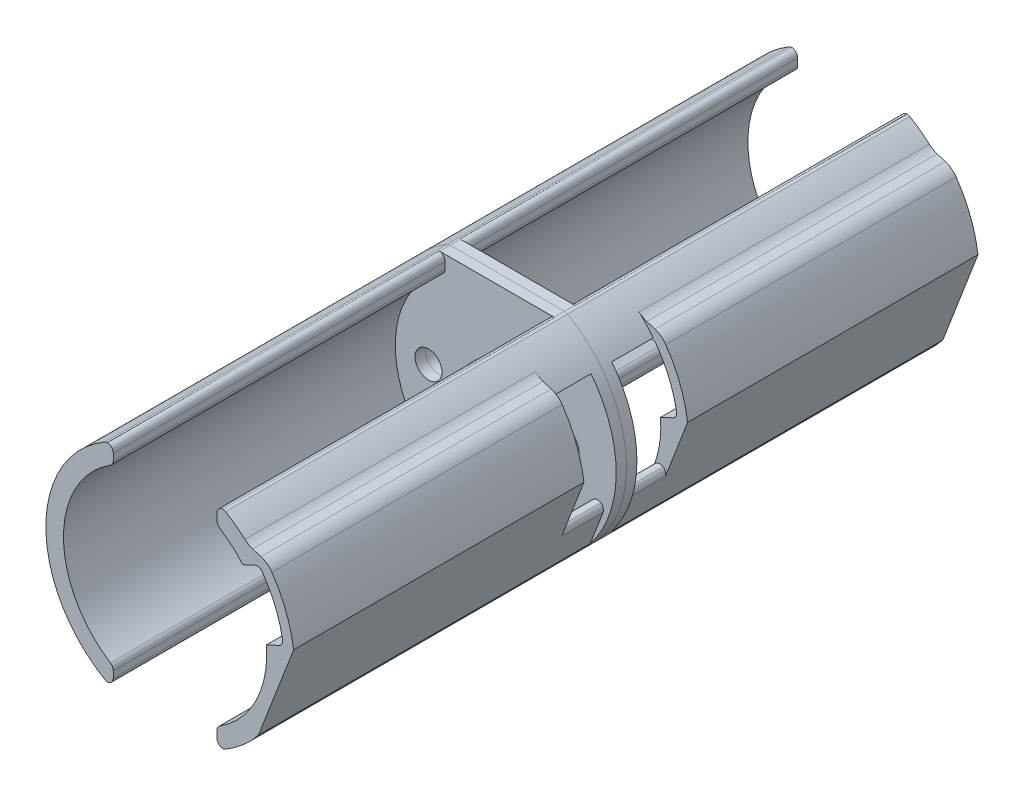
from build123d import *

# Parameters (mm, degrees)
SKETCH1_R           = 14.605
SKETCH1_R_2         = 12.446
BOSS_EXTRUDE1_DEPTH = 40.64
BOSS_EXTRUDE2_START = 1.27
SKETCH2_R           = 14.605
SKETCH2_R_2         = 3.556
SKETCH2_R_3         = 1.651
BOSS_EXTRUDE2_DEPTH = 1.27
SKETCH3_W           = 34.056453184
SKETCH3_H           = 6.418177278
SKETCH3_W_2         = 34.979066167
SKETCH3_H_2         = 5.575791511
CUT_EXTRUDE1_DEPTH  = 47.723229233
SKETCH4_W           = 12.7
SKETCH4_H           = 40.64
CUT_EXTRUDE2_DEPTH  = 51.100654936
CUT_EXTRUDE3_DEPTH  = 40.64
BOSS_EXTRUDE3_DEPTH = 41.91
SKETCH7_R           = 15.875
SKETCH7_R_2         = 14.605
CUT_EXTRUDE4_DEPTH  = 6.35
CUT_EXTRUDE5_DEPTH  = 5.08
CUT_EXTRUDE6_REACH  = 48.533
BOSS_EXTRUDE5_DEPTH = 35.56
FILLET1_R           = 0.762
FILLET2_R           = 2.54


with BuildPart() as part:
    # Sketch1 → Boss-Extrude1 (new body)
    with BuildSketch(Plane.XY):
        Circle(SKETCH1_R)
        Circle(SKETCH1_R_2, mode=Mode.SUBTRACT)
    extrude(amount=BOSS_EXTRUDE1_DEPTH)

    # Sketch2 → Boss-Extrude2 (add)
    with BuildSketch(Plane(origin=(0, 0, 0), x_dir=(-1, 0, 0), z_dir=(0, 0, -1)).offset(BOSS_EXTRUDE2_START)):
        Circle(SKETCH2_R)
        Circle(SKETCH2_R_2, mode=Mode.SUBTRACT)
        with Locations((-8.382, 0)):
            Circle(SKETCH2_R_3, mode=Mode.SUBTRACT)
        with Locations((8.382, 0)):
            Circle(SKETCH2_R_3, mode=Mode.SUBTRACT)
    extrude(amount=-BOSS_EXTRUDE2_DEPTH)

    # Sketch3 → Cut-Extrude1 (cut, through all)
    with BuildSketch(Plane(origin=(0, 0, -1.27), x_dir=(-1, 0, 0), z_dir=(0, 0, -1))):
        with Locations((0.581647316, 15.909088639)):
            Rectangle(SKETCH3_W, SKETCH3_H)
        with Locations((1.042953807, -15.487895756)):
            Rectangle(SKETCH3_W_2, SKETCH3_H_2)
    extrude(amount=-CUT_EXTRUDE1_DEPTH, mode=Mode.SUBTRACT)

    # Sketch4 → Cut-Extrude2 (cut, through all)
    with BuildSketch(Plane(origin=(0, 12.7, 0), x_dir=(1, 0, 0), z_dir=(0, 1, 0))):
        with Locations((0, -20.32)):
            Rectangle(SKETCH4_W, SKETCH4_H)
    extrude(amount=-CUT_EXTRUDE2_DEPTH, mode=Mode.SUBTRACT)

    # Sketch5 → Cut-Extrude3 (cut)
    with BuildSketch(Plane.XY.offset(40.64)):
        Polygon((8.706975565, 7.656948551), (15.156085268, 10.664217794), (18.376436422, 3.758152456), (11.927326719, 0.750883214), align=None)
    extrude(amount=-CUT_EXTRUDE3_DEPTH, mode=Mode.SUBTRACT)

    # Sketch6 → Boss-Extrude3 (add)
    with BuildSketch(Plane(origin=(0, 0, -1.27), x_dir=(-1, 0, 0), z_dir=(0, 0, -1))):
        with BuildLine():
            Line((-12.527218586, 9.751124012), (-10.16966665, 10.48255242))
            ThreePointArc((-10.16966665, 10.48255242), (-10.873649709, 9.75037266), (-11.525041099, 8.971034091))
            ThreePointArc((-11.525041099, 8.971034091), (-13.467409843, 5.651096984), (-14.475687068, 1.93920316))
            ThreePointArc((-14.475687068, 1.93920316), (-14.575462242, 0.928399389), (-14.604741501, -0.086894693))
            Line((-14.604741501, -0.086894693), (-15.734442466, 2.107829522))
            ThreePointArc((-15.734442466, 2.107829522), (-14.638488959, 6.142496722), (-12.527218586, 9.751124012))
        make_face()
    extrude(amount=-BOSS_EXTRUDE3_DEPTH)

    # Sketch7 → Cut-Extrude4 (cut)
    with BuildSketch(Plane(origin=(0, 0, -1.27), x_dir=(-1, 0, 0), z_dir=(0, 0, -1))):
        Circle(SKETCH7_R)
        Circle(SKETCH7_R_2, mode=Mode.SUBTRACT)
    extrude(amount=-CUT_EXTRUDE4_DEPTH, mode=Mode.SUBTRACT)

    # Sketch8 → Cut-Extrude5 (cut)
    with BuildSketch(Plane.XY):
        with BuildLine():
            Line((14.475687068, 1.93920316), (12.407758156, 0.974912072))
            ThreePointArc((12.407758156, 0.974912072), (12.445878018, -0.05510311), (12.398639212, -1.084740374))
            Line((12.398639212, -1.084740374), (14.549423566, -1.272909623))
            ThreePointArc((14.549423566, -1.272909623), (14.601153344, 0.335180604), (14.475687068, 1.93920316))
        make_face()
        with BuildLine():
            Line((14.549423566, -1.272909623), (12.398639212, -1.084740374))
            ThreePointArc((12.398639212, -1.084740374), (12.226851946, -2.325297292), (11.931259886, -3.542309069))
            Line((11.931259886, -3.542309069), (13.780666558, -4.837277563))
            ThreePointArc((13.780666558, -4.837277563), (14.276718156, -3.079179062), (14.549423566, -1.272909623))
        make_face()
    extrude(amount=CUT_EXTRUDE5_DEPTH, mode=Mode.SUBTRACT)

    # Cut-Extrude6: up to this face of the body (flat: up to its plane)
    cut_extrude6_end = Plane(part.part.faces().sort_by_distance((9.524357094, -7.422304107, 0))[0])
    # Sketch11 → Cut-Extrude6 (cut, up to the picked face)
    with BuildSketch(Plane.XY.offset(40.64), mode=Mode.PRIVATE) as cut_extrude6_sk1:
        Polygon((15.734442466, 2.107829522), (11.428920073, -9.093173867), (14.392518886, -10.232343334), (18.698041279, 0.968660056), align=None)
    cut_extrude6_tool1 = split(extrude(cut_extrude6_sk1.sketch, amount=-CUT_EXTRUDE6_REACH, mode=Mode.PRIVATE), bisect_by=cut_extrude6_end, keep=Keep.BOTH, mode=Mode.PRIVATE)
    add(cut_extrude6_tool1.solids().sort_by(Axis((15.063481, -4.062257, 40.64), (0, 0, -1)))[0], mode=Mode.SUBTRACT)

    # Sketch12 → Boss-Extrude5 (add)
    with BuildSketch(Plane.XY.offset(40.64)):
        Polygon((14.577046288, -0.903186872), (15.734442466, 2.107829522), (15.155744377, 2.330273663), (13.998348199, -0.680742731), align=None)
    extrude(amount=-BOSS_EXTRUDE5_DEPTH)

    # Fillet1
    # the kernel refuses this fillet: 0.762 mm, written as the material it adds along each edge
    with BuildSketch(Plane(origin=(14.475687068, 1.93920316, 40.64), x_dir=(-0.1526781379658876, 0.9882759666142191, 0), z_dir=(0, 0, -1))) as fillet1_piece_1:
        with BuildLine():
            CenterArc((0.57198511, -0.76184596), FILLET1_R, 88.847914045, 74.934246566)
            Line((-0.159692452, -0.549026914), (0, 0))
            ThreePointArc((0, 0), (0.29365307, 0.002952442), (0.587306139, 0))
        make_face()
    extrude(amount=35.56)
    with BuildSketch(Plane(origin=(11.525041099, 8.971034091, 40.64), x_dir=(0.5968718617370223, -0.8023365756754336, 0), z_dir=(0, 0, -1))) as fillet1_piece_2:
        with BuildLine():
            CenterArc((0.62099819, 0.761818426), FILLET1_R, 191.646188227, 79.60463439)
            Line((-0.12531439, 0.60799537), (0, 0))
            ThreePointArc((0, 0), (0.318816035, -0.00348017), (0.63763207, 0))
        make_face()
    extrude(amount=35.56)
    # the kernel refuses this fillet: 0.762 mm, written as the material it takes off along each edge
    with BuildSketch(Plane(origin=(0, 0, 0), x_dir=(-1, 0, 0), z_dir=(0, -1, 0))) as fillet1_2_piece_1:
        with BuildLine():
            CenterArc((3.556 + FILLET1_R, FILLET1_R), FILLET1_R, 180, 90)
            Line((3.556, FILLET1_R), (3.556, 0))
            Line((3.556, 0), (3.556 + FILLET1_R, 0))
        make_face()
    revolve(axis=Axis((0, 0, 0), (0, 0, -1)), mode=Mode.SUBTRACT)
    with BuildSketch(Plane(origin=(11.931259886, -3.542309069, 0), x_dir=(-0.32230782021248533, -0.9466349185561855, 0), z_dir=(0, 0, 1))) as fillet1_2_piece_2:
        with BuildLine():
            CenterArc((1.014668485, 0.761403744), FILLET1_R, 163.802549626, 103.930693134)
            Line((0.282915237, 0.973962404), (0, 0))
            ThreePointArc((0, 0), (0.492264909, 0.009738855), (0.984529818, 0))
        make_face()
    extrude(amount=5.08, mode=Mode.SUBTRACT)
    with BuildSketch(Plane(origin=(13.216640292, -4.442342119, 0), x_dir=(-0.35879353276176223, -0.9334169490899199, 0), z_dir=(0, 0, 1))) as fillet1_2_piece_3:
        with BuildLine():
            CenterArc((FILLET1_R * 0.781652785228, -FILLET1_R), FILLET1_R, 90, 76.026121217)
            Line((-FILLET1_R * 0.1887531327, -FILLET1_R * 0.758520488551), (0, 0))
            Line((0, 0), (FILLET1_R * 0.781652785228, 0))
        make_face()
    extrude(amount=5.08, mode=Mode.SUBTRACT)
    with BuildSketch(Plane(origin=(-7.212213599, 12.7, -1.794261411), x_dir=(1, 0, 0), z_dir=(0, 0, 1)), Plane(origin=(-7.212213599, -12.7, 41.164261411), x_dir=(1, 0, 0), z_dir=(0, 0, -1))) as fillet1_2_piece_4:
        with BuildLine():
            CenterArc((0.204160731, -0.762), FILLET1_R, 90, 30.414529102)
            ThreePointArc((-0.181603647, -0.104862385), (-0.090990033, -0.052105246), (0, 0))
            Line((0, 0), (0.204160731, 0))
        make_face()
    extrude(amount=42.958522823, mode=Mode.SUBTRACT)
    with BuildSketch(Plane(origin=(7.212213599, 12.7, -1.794261411), x_dir=(0.8659975867148599, -0.500048177482969, -1.8558242316030044e-14), z_dir=(0, 0, 1)), Plane(origin=(7.212213599, -12.7, 41.164261411), x_dir=(0.8659975867148587, 0.5000481774829708, -1.8313973834794986e-14), z_dir=(0, 0, -1))) as fillet1_2_piece_5:
        with BuildLine():
            CenterArc((0.204234011, -0.761980363), FILLET1_R, 89.588658346, 30.414529102)
            Line((-0.176802701, -0.102090202), (0, 0))
            ThreePointArc((0, 0), (0.104852282, 0.000376383), (0.209704565, 0))
        make_face()
    extrude(amount=42.958522823, mode=Mode.SUBTRACT)
    with BuildSketch(Plane(origin=(-6.35, 10.704224213, 41.703745389), x_dir=(0, 1, 0), z_dir=(0, 0, -1))) as fillet1_2_piece_6:
        with BuildLine():
            CenterArc((0.425498156, -0.762), FILLET1_R, 90, 57.421029607)
            ThreePointArc((-0.216601212, -0.351692308), (-0.106841566, -0.176744751), (0, 0))
            Line((0, 0), (0.425498156, 0))
        make_face()
    extrude(amount=41.703745389, mode=Mode.SUBTRACT)
    with BuildSketch(Plane(origin=(-6.35, -10.704224213, 41.703745389), x_dir=(0, -1, 0), z_dir=(0, 0, -1)), Plane(origin=(6.35, 10.704224213, 41.703745389), x_dir=(0, 1, 0), z_dir=(0, 0, -1))) as fillet1_2_piece_7:
        with BuildLine():
            CenterArc((0.425498156, 0.762), FILLET1_R, 212.578970393, 57.421029607)
            ThreePointArc((-0.216601212, 0.351692308), (-0.106841566, 0.176744751), (0, 0))
            Line((0, 0), (0.425498156, 0))
        make_face()
    extrude(amount=41.703745389, mode=Mode.SUBTRACT)
    with BuildSketch(Plane(origin=(6.35, -10.704224213, 41.703745389), x_dir=(0.8514689576122441, 0.5244050097231324, 0), z_dir=(0, 0, -1))) as fillet1_2_piece_8:
        with BuildLine():
            CenterArc((0.425685981, 0.761895088), FILLET1_R, 211.628197432, 57.421029608)
            Line((-0.223133364, 0.362298471), (0, 0))
            ThreePointArc((0, 0), (0.206520922, 0.001713556), (0.413041843, 0))
        make_face()
    extrude(amount=41.703745389, mode=Mode.SUBTRACT)
    with BuildSketch(Plane(origin=(6.35, -12.7, 42.545), x_dir=(1, 0, 0), z_dir=(0, 0, -1)), Plane(origin=(-6.35, -12.7, 0), x_dir=(-1, 0, 0), z_dir=(0, 0, 1))) as fillet1_2_piece_9:
        with BuildLine():
            CenterArc((FILLET1_R, -FILLET1_R), FILLET1_R, 90, 90)
            Line((0, -FILLET1_R), (0, 0))
            Line((0, 0), (FILLET1_R, 0))
        make_face()
    extrude(amount=42.545, mode=Mode.SUBTRACT)
    with BuildSketch(Plane(origin=(-6.35, 12.7, 0), x_dir=(-1, 0, 0), z_dir=(0, 0, 1)), Plane(origin=(6.35, 12.7, 42.545), x_dir=(1, 0, 0), z_dir=(0, 0, -1))) as fillet1_2_piece_10:
        with BuildLine():
            CenterArc((FILLET1_R, FILLET1_R), FILLET1_R, 180, 90)
            Line((0, FILLET1_R), (0, 0))
            Line((0, 0), (FILLET1_R, 0))
        make_face()
    extrude(amount=42.545, mode=Mode.SUBTRACT)

    # Fillet2
    fillet2_edges = [part.edges().sort_by_distance(p)[0] for p in [
        (12.527218586, 9.751124012, 22.86),
        (10.16966665, 10.48255242, 22.86),
    ]]
    fillet(fillet2_edges, radius=FILLET2_R)


with BuildPart() as body_2:
    # Mirror1: mirrored copy
    add(part.part.mirror(Plane(origin=(0, 0, -1.27), x_dir=(1, 0, 0), z_dir=(0, 0, -1))))


solid = Compound([part.part, body_2.part])
